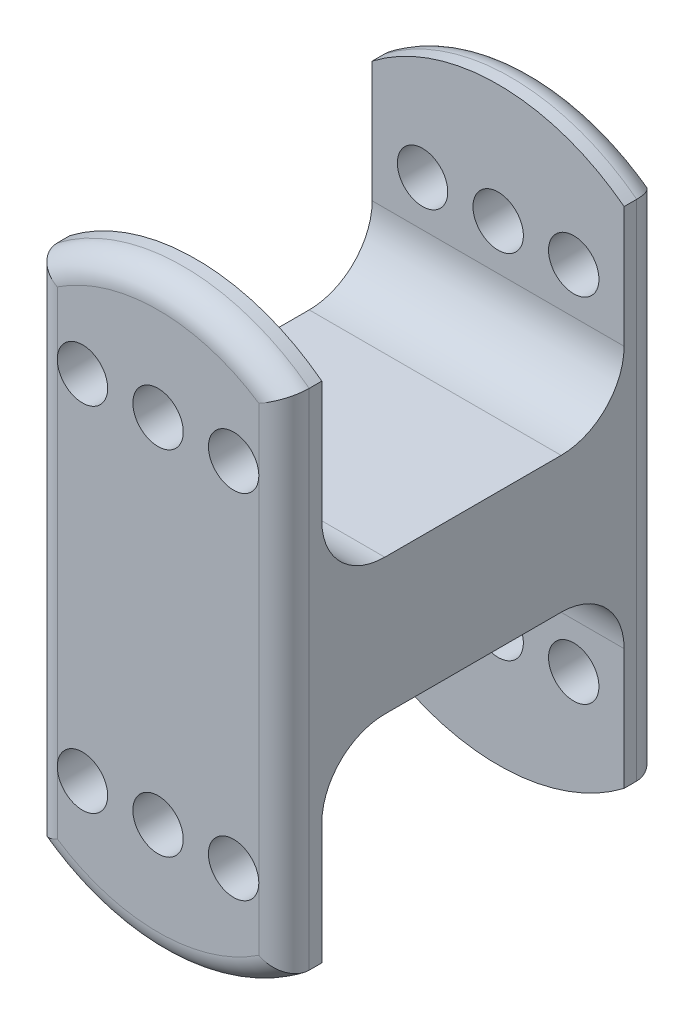
from build123d import *

# Parameters (mm, degrees)
SKETCH1_R           = 2
BOSS_EXTRUDE1_DEPTH = 30
SKETCH2_W           = 24
SKETCH2_H           = 18
CUT_EXTRUDE1_DEPTH  = 48.136701039
FILLET1_R           = 5
FILLET2_R           = 2


with BuildPart() as part:
    # Sketch1 → Boss-Extrude1 (new body)
    with BuildSketch(Plane.XY):
        with BuildLine():
            Line((-10, -13.032253728), (-10, 26.967746272))
            ThreePointArc((-10, 26.967746272), (0, 30.36228886), (10, 26.967746272))
            Line((10, 26.967746272), (10, -13.032253728))
            ThreePointArc((10, -13.032253728), (0, -16.426796317), (-10, -13.032253728))
        make_face()
        with Locations((0, -7.032253728)):
            Circle(SKETCH1_R, mode=Mode.SUBTRACT)
        with Locations((6, -7.032253728)):
            Circle(SKETCH1_R, mode=Mode.SUBTRACT)
        with Locations((-6, -7.032253728)):
            Circle(SKETCH1_R, mode=Mode.SUBTRACT)
        with Locations(Location((6, 20.967746272, 0), (0, 0, 180))):
            Circle(SKETCH1_R, mode=Mode.SUBTRACT)
        with Locations(Location((0, 20.967746272, 0), (0, 0, 180))):
            Circle(SKETCH1_R, mode=Mode.SUBTRACT)
        with Locations(Location((-6, 20.967746272, 0), (0, 0, 180))):
            Circle(SKETCH1_R, mode=Mode.SUBTRACT)
    extrude(amount=BOSS_EXTRUDE1_DEPTH)

    # Sketch2 → Cut-Extrude1 (cut, through all)
    with BuildSketch(Plane(origin=(10, 0, 0), x_dir=(0, 0, -1), z_dir=(1, 0, 0))):
        with Locations((-15, -7.426796317)):
            Rectangle(SKETCH2_W, SKETCH2_H)
        with Locations((-15, 21.36228886)):
            Rectangle(SKETCH2_W, SKETCH2_H)
    extrude(amount=-CUT_EXTRUDE1_DEPTH, mode=Mode.SUBTRACT)

    # Fillet1
    fillet1_edges = [part.edges().sort_by_distance(p)[0] for p in [
        (0, 1.573203683, 3),
        (0, 1.573203683, 27),
        (0, 12.36228886, 27),
        (0, 12.36228886, 3),
    ]]
    fillet(fillet1_edges, radius=FILLET1_R)

    # Fillet2
    fillet2_edges = [part.edges().sort_by_distance(p)[0] for p in [
        (0, -16.426796317, 30),
        (10, 6.967746272, 30),
        (0, 30.36228886, 30),
        (10, 6.967746272, 0),
        (0, -16.426796317, 0),
        (-10, 6.967746272, 0),
        (0, 30.36228886, 0),
        (-10, 6.967746272, 30),
    ]]
    fillet(fillet2_edges, radius=FILLET2_R - 0.0001)  # a hair under: the kernel refuses the full size


solid = part.part
